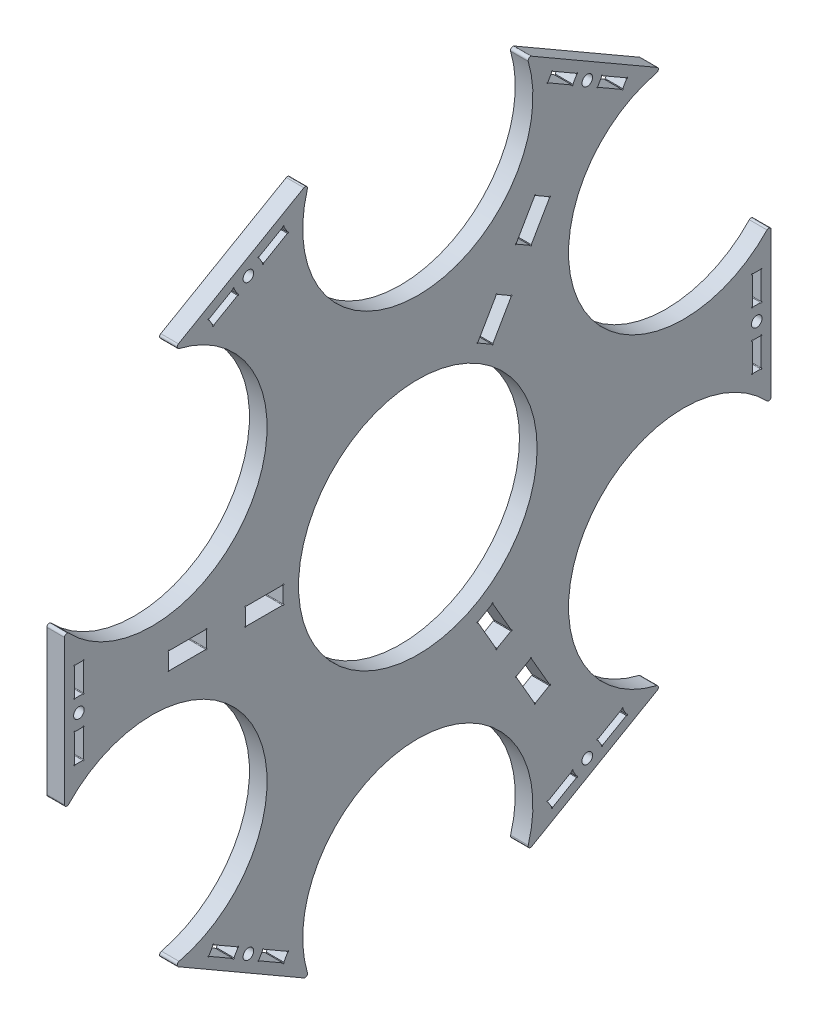
from build123d import *

# Parameters (mm, degrees)
SKETCH2_R           = 39.487475
BOSS_EXTRUDE1_DEPTH = 5.842
FILLET1_R           = 0.79375
SKETCH4_W           = 12.499999946
SKETCH4_H           = 5.742
CUT_EXTRUDE3_DEPTH  = 163.986308211
SKETCH5_R           = 0.1984375
CUT_EXTRUDE4_DEPTH  = 163.986308211
SKETCH6_R           = 1.7526
CUT_EXTRUDE5_DEPTH  = 163.986308211
CUT_EXTRUDE6_DEPTH  = 163.986308211


with BuildPart() as part:
    # Sketch2 → Boss-Extrude1 (new body)
    with BuildSketch(Plane(origin=(0, 0, 0), x_dir=(0, 0, -1), z_dir=(1, 0, 0))):
        with BuildLine():
            ThreePointArc((116.947215895, 26.041480267), (54.99261314, 31.75), (81.02619141, 88.258519733))
            Line((81.02619141, 88.258519733), (35.921024484, 114.3))
            ThreePointArc((35.921024484, 114.3), (0, 63.5), (-35.921024484, 114.3))
            Line((-35.921024484, 114.3), (-81.02619141, 88.258519733))
            ThreePointArc((-81.02619141, 88.258519733), (-54.99261314, 31.75), (-116.947215895, 26.041480267))
            Line((-116.947215895, 26.041480267), (-116.947215895, -26.041480267))
            ThreePointArc((-116.947215895, -26.041480267), (-54.99261314, -31.75), (-81.02619141, -88.258519733))
            Line((-81.02619141, -88.258519733), (-35.921024484, -114.3))
            ThreePointArc((-35.921024484, -114.3), (0, -63.5), (35.921024484, -114.3))
            Line((35.921024484, -114.3), (81.02619141, -88.258519733))
            ThreePointArc((81.02619141, -88.258519733), (54.99261314, -31.75), (116.947215895, -26.041480267))
            Line((116.947215895, -26.041480267), (116.947215895, 26.041480267))
        make_face()
        Circle(SKETCH2_R, mode=Mode.SUBTRACT)
    extrude(amount=BOSS_EXTRUDE1_DEPTH)

    # Fillet1
    fillet1_edges = [part.edges().sort_by_distance(p)[0] for p in [
        (2.921, -114.3, 35.921024484),
        (2.921, -114.3, -35.921024484),
        (2.921, -88.258519733, -81.02619141),
        (2.921, -26.041480267, -116.947215895),
        (2.921, 88.258519733, -81.02619141),
        (2.921, 26.041480267, -116.947215895),
        (2.921, -88.258519733, 81.02619141),
        (2.921, -26.041480267, 116.947215895),
        (2.921, 26.041480267, 116.947215895),
        (2.921, 88.258519733, 81.02619141),
        (2.921, 114.3, -35.921024484),
        (2.921, 114.3, 35.921024484),
    ]]
    fillet(fillet1_edges, radius=FILLET1_R)

    # Sketch4 → Cut-Extrude3 (cut, through all)
    with BuildSketch(Plane(origin=(5.842, 0, 0), x_dir=(0, 0, -1), z_dir=(1, 0, 0))):
        Polygon((26.038641052, 50.842249263), (19.788641079, 40.016931762), (24.761358948, 37.145931762), (31.011358921, 47.971249263), align=None)
        Polygon((31.011358921, -47.971249263), (24.761358948, -37.145931762), (19.788641079, -40.016931762), (26.038641052, -50.842249263), align=None)
        with Locations((-50.8, 0)):
            Rectangle(SKETCH4_W, SKETCH4_H)
    extrude(amount=-CUT_EXTRUDE3_DEPTH, mode=Mode.SUBTRACT)

    # Sketch5 → Cut-Extrude4 (cut, through all)
    with BuildSketch(Plane(origin=(5.842, 0, 0), x_dir=(0, 0, -1), z_dir=(1, 0, 0))):
        with Locations((26.038641052, 50.842249263)):
            Circle(SKETCH5_R)
        with Locations((31.011358921, 47.971249263)):
            Circle(SKETCH5_R)
        with Locations((24.761358948, 37.145931762)):
            Circle(SKETCH5_R)
        with Locations((19.788641079, 40.016931762)):
            Circle(SKETCH5_R)
        with Locations((31.011358921, -47.971249263)):
            Circle(SKETCH5_R)
        with Locations((26.038641052, -50.842249263)):
            Circle(SKETCH5_R)
        with Locations((19.788641079, -40.016931762)):
            Circle(SKETCH5_R)
        with Locations((24.761358948, -37.145931762)):
            Circle(SKETCH5_R)
        with Locations((-57.049999973, -2.871)):
            Circle(SKETCH5_R)
        with Locations((-57.049999973, 2.871)):
            Circle(SKETCH5_R)
        with Locations((-44.550000027, 2.871)):
            Circle(SKETCH5_R)
        with Locations((-44.550000027, -2.871)):
            Circle(SKETCH5_R)
    extrude(amount=-CUT_EXTRUDE4_DEPTH, mode=Mode.SUBTRACT)

    # Sketch6 → Cut-Extrude5 (cut, through all)
    with BuildSketch(Plane(origin=(5.842, 0, 0), x_dir=(0, 0, -1), z_dir=(1, 0, 0))):
        with Locations((-56.092357947, 97.154813881)):
            Circle(SKETCH6_R)
        with Locations((56.092357947, 97.154813881)):
            Circle(SKETCH6_R)
        with Locations((112.184715895, 0)):
            Circle(SKETCH6_R)
        with Locations((56.092357947, -97.154813881)):
            Circle(SKETCH6_R)
        with Locations((-56.092357947, -97.154813881)):
            Circle(SKETCH6_R)
        with Locations((-112.184715895, 0)):
            Circle(SKETCH6_R)
        with BuildLine():
            Line((-67.550093988, 88.822069843), (-59.644905849, 93.386132343))
            ThreePointArc((-59.644905849, 93.386132343), (-59.281378027, 93.433991689), (-59.572272683, 93.657203009))
            Line((-59.572272683, 93.657203009), (-60.861335183, 95.889924753))
            ThreePointArc((-60.861335183, 95.889924753), (-60.909194529, 96.253452575), (-61.132405849, 95.962557919))
            Line((-61.132405849, 95.962557919), (-69.037593988, 91.398495419))
            ThreePointArc((-69.037593988, 91.398495419), (-69.40112181, 91.350636074), (-69.110227154, 91.127424753))
            Line((-69.110227154, 91.127424753), (-67.821164654, 88.894703009))
            ThreePointArc((-67.821164654, 88.894703009), (-67.773305308, 88.531175187), (-67.550093988, 88.822069843))
        make_face()
        with BuildLine():
            Line((-44.634621907, 105.487557919), (-52.539810046, 100.923495419))
            ThreePointArc((-52.539810046, 100.923495419), (-52.903337868, 100.875636074), (-52.612443212, 100.652424753))
            Line((-52.612443212, 100.652424753), (-51.323380712, 98.419703009))
            ThreePointArc((-51.323380712, 98.419703009), (-51.275521366, 98.056175187), (-51.052310046, 98.347069843))
            Line((-51.052310046, 98.347069843), (-43.147121907, 102.911132343))
            ThreePointArc((-43.147121907, 102.911132343), (-42.783594085, 102.958991689), (-43.074488741, 103.182203009))
            Line((-43.074488741, 103.182203009), (-44.363551241, 105.414924753))
            ThreePointArc((-44.363551241, 105.414924753), (-44.411410587, 105.778452575), (-44.634621907, 105.487557919))
        make_face()
        with BuildLine():
            Line((43.147121907, 102.911132343), (51.052310046, 98.347069843))
            ThreePointArc((51.052310046, 98.347069843), (51.275521366, 98.056175187), (51.323380712, 98.419703009))
            Line((51.323380712, 98.419703009), (52.612443212, 100.652424753))
            ThreePointArc((52.612443212, 100.652424753), (52.903337868, 100.875636074), (52.539810046, 100.923495419))
            Line((52.539810046, 100.923495419), (44.634621907, 105.487557919))
            ThreePointArc((44.634621907, 105.487557919), (44.411410587, 105.778452575), (44.363551241, 105.414924753))
            Line((44.363551241, 105.414924753), (43.074488741, 103.182203009))
            ThreePointArc((43.074488741, 103.182203009), (42.783594085, 102.958991689), (43.147121907, 102.911132343))
        make_face()
        with BuildLine():
            Line((69.037593988, 91.398495419), (61.132405849, 95.962557919))
            ThreePointArc((61.132405849, 95.962557919), (60.909194529, 96.253452575), (60.861335183, 95.889924753))
            Line((60.861335183, 95.889924753), (59.572272683, 93.657203009))
            ThreePointArc((59.572272683, 93.657203009), (59.281378027, 93.433991689), (59.644905849, 93.386132343))
            Line((59.644905849, 93.386132343), (67.550093988, 88.822069843))
            ThreePointArc((67.550093988, 88.822069843), (67.773305308, 88.531175187), (67.821164654, 88.894703009))
            Line((67.821164654, 88.894703009), (69.110227154, 91.127424753))
            ThreePointArc((69.110227154, 91.127424753), (69.40112181, 91.350636074), (69.037593988, 91.398495419))
        make_face()
        with BuildLine():
            Line((110.697215895, 14.0890625), (110.697215895, 4.9609375))
            ThreePointArc((110.697215895, 4.9609375), (110.556899393, 4.622183498), (110.895653395, 4.7625))
            Line((110.895653395, 4.7625), (113.473778395, 4.7625))
            ThreePointArc((113.473778395, 4.7625), (113.812532397, 4.622183498), (113.672215895, 4.9609375))
            Line((113.672215895, 4.9609375), (113.672215895, 14.0890625))
            ThreePointArc((113.672215895, 14.0890625), (113.812532397, 14.427816502), (113.473778395, 14.2875))
            Line((113.473778395, 14.2875), (110.895653395, 14.2875))
            ThreePointArc((110.895653395, 14.2875), (110.556899393, 14.427816502), (110.697215895, 14.0890625))
        make_face()
        with BuildLine():
            Line((113.672215895, -14.0890625), (113.672215895, -4.9609375))
            ThreePointArc((113.672215895, -4.9609375), (113.812532397, -4.622183498), (113.473778395, -4.7625))
            Line((113.473778395, -4.7625), (110.895653395, -4.7625))
            ThreePointArc((110.895653395, -4.7625), (110.556899393, -4.622183498), (110.697215895, -4.9609375))
            Line((110.697215895, -4.9609375), (110.697215895, -14.0890625))
            ThreePointArc((110.697215895, -14.0890625), (110.556899393, -14.427816502), (110.895653395, -14.2875))
            Line((110.895653395, -14.2875), (113.473778395, -14.2875))
            ThreePointArc((113.473778395, -14.2875), (113.812532397, -14.427816502), (113.672215895, -14.0890625))
        make_face()
        with BuildLine():
            Line((67.550093988, -88.822069843), (59.644905849, -93.386132343))
            ThreePointArc((59.644905849, -93.386132343), (59.281378027, -93.433991689), (59.572272683, -93.657203009))
            Line((59.572272683, -93.657203009), (60.861335183, -95.889924753))
            ThreePointArc((60.861335183, -95.889924753), (60.909194529, -96.253452575), (61.132405849, -95.962557919))
            Line((61.132405849, -95.962557919), (69.037593988, -91.398495419))
            ThreePointArc((69.037593988, -91.398495419), (69.40112181, -91.350636074), (69.110227154, -91.127424753))
            Line((69.110227154, -91.127424753), (67.821164654, -88.894703009))
            ThreePointArc((67.821164654, -88.894703009), (67.773305308, -88.531175187), (67.550093988, -88.822069843))
        make_face()
        with BuildLine():
            Line((44.634621907, -105.487557919), (52.539810046, -100.923495419))
            ThreePointArc((52.539810046, -100.923495419), (52.903337868, -100.875636074), (52.612443212, -100.652424753))
            Line((52.612443212, -100.652424753), (51.323380712, -98.419703009))
            ThreePointArc((51.323380712, -98.419703009), (51.275521366, -98.056175187), (51.052310046, -98.347069843))
            Line((51.052310046, -98.347069843), (43.147121907, -102.911132343))
            ThreePointArc((43.147121907, -102.911132343), (42.783594085, -102.958991689), (43.074488741, -103.182203009))
            Line((43.074488741, -103.182203009), (44.363551241, -105.414924753))
            ThreePointArc((44.363551241, -105.414924753), (44.411410587, -105.778452575), (44.634621907, -105.487557919))
        make_face()
        with BuildLine():
            Line((-43.147121907, -102.911132343), (-51.052310046, -98.347069843))
            ThreePointArc((-51.052310046, -98.347069843), (-51.275521366, -98.056175187), (-51.323380712, -98.419703009))
            Line((-51.323380712, -98.419703009), (-52.612443212, -100.652424753))
            ThreePointArc((-52.612443212, -100.652424753), (-52.903337868, -100.875636074), (-52.539810046, -100.923495419))
            Line((-52.539810046, -100.923495419), (-44.634621907, -105.487557919))
            ThreePointArc((-44.634621907, -105.487557919), (-44.411410587, -105.778452575), (-44.363551241, -105.414924753))
            Line((-44.363551241, -105.414924753), (-43.074488741, -103.182203009))
            ThreePointArc((-43.074488741, -103.182203009), (-42.783594085, -102.958991689), (-43.147121907, -102.911132343))
        make_face()
        with BuildLine():
            Line((-69.037593988, -91.398495419), (-61.132405849, -95.962557919))
            ThreePointArc((-61.132405849, -95.962557919), (-60.909194529, -96.253452575), (-60.861335183, -95.889924753))
            Line((-60.861335183, -95.889924753), (-59.572272683, -93.657203009))
            ThreePointArc((-59.572272683, -93.657203009), (-59.281378027, -93.433991689), (-59.644905849, -93.386132343))
            Line((-59.644905849, -93.386132343), (-67.550093988, -88.822069843))
            ThreePointArc((-67.550093988, -88.822069843), (-67.773305308, -88.531175187), (-67.821164654, -88.894703009))
            Line((-67.821164654, -88.894703009), (-69.110227154, -91.127424753))
            ThreePointArc((-69.110227154, -91.127424753), (-69.40112181, -91.350636074), (-69.037593988, -91.398495419))
        make_face()
        with BuildLine():
            Line((-110.697215895, -14.0890625), (-110.697215895, -4.9609375))
            ThreePointArc((-110.697215895, -4.9609375), (-110.556899393, -4.622183498), (-110.895653395, -4.7625))
            Line((-110.895653395, -4.7625), (-113.473778395, -4.7625))
            ThreePointArc((-113.473778395, -4.7625), (-113.812532397, -4.622183498), (-113.672215895, -4.9609375))
            Line((-113.672215895, -4.9609375), (-113.672215895, -14.0890625))
            ThreePointArc((-113.672215895, -14.0890625), (-113.812532397, -14.427816502), (-113.473778395, -14.2875))
            Line((-113.473778395, -14.2875), (-110.895653395, -14.2875))
            ThreePointArc((-110.895653395, -14.2875), (-110.556899393, -14.427816502), (-110.697215895, -14.0890625))
        make_face()
        with BuildLine():
            Line((-113.672215895, 14.0890625), (-113.672215895, 4.9609375))
            ThreePointArc((-113.672215895, 4.9609375), (-113.812532397, 4.622183498), (-113.473778395, 4.7625))
            Line((-113.473778395, 4.7625), (-110.895653395, 4.7625))
            ThreePointArc((-110.895653395, 4.7625), (-110.556899393, 4.622183498), (-110.697215895, 4.9609375))
            Line((-110.697215895, 4.9609375), (-110.697215895, 14.0890625))
            ThreePointArc((-110.697215895, 14.0890625), (-110.556899393, 14.427816502), (-110.895653395, 14.2875))
            Line((-110.895653395, 14.2875), (-113.473778395, 14.2875))
            ThreePointArc((-113.473778395, 14.2875), (-113.812532397, 14.427816502), (-113.672215895, 14.0890625))
        make_face()
    extrude(amount=-CUT_EXTRUDE5_DEPTH, mode=Mode.SUBTRACT)

    # Sketch7 → Cut-Extrude6 (cut, through all)
    with BuildSketch(Plane(origin=(5.842, 0, 0), x_dir=(0, 0, -1), z_dir=(1, 0, 0))):
        with BuildLine():
            Line((38.910492968, -72.740075769), (43.539507005, -70.067513269))
            ThreePointArc((43.539507005, -70.067513269), (43.903034827, -70.019653923), (43.612140171, -69.796442603))
            Line((43.612140171, -69.796442603), (37.560577698, -59.314828934))
            ThreePointArc((37.560577698, -59.314828934), (37.512718352, -58.951301112), (37.289507032, -59.242195768))
            Line((37.289507032, -59.242195768), (32.660492995, -61.914758268))
            ThreePointArc((32.660492995, -61.914758268), (32.296965173, -61.962617614), (32.587859829, -62.185828934))
            Line((32.587859829, -62.185828934), (38.639422302, -72.667442603))
            ThreePointArc((38.639422302, -72.667442603), (38.687281648, -73.030970425), (38.910492968, -72.740075769))
        make_face()
        with BuildLine():
            Line((43.539507005, 70.067513269), (38.910492968, 72.740075769))
            ThreePointArc((38.910492968, 72.740075769), (38.687281648, 73.030970425), (38.639422302, 72.667442603))
            Line((38.639422302, 72.667442603), (32.587859829, 62.185828934))
            ThreePointArc((32.587859829, 62.185828934), (32.296965173, 61.962617614), (32.660492995, 61.914758268))
            Line((32.660492995, 61.914758268), (37.289507032, 59.242195768))
            ThreePointArc((37.289507032, 59.242195768), (37.512718352, 58.951301112), (37.560577698, 59.314828934))
            Line((37.560577698, 59.314828934), (43.612140171, 69.796442603))
            ThreePointArc((43.612140171, 69.796442603), (43.903034827, 70.019653923), (43.539507005, 70.067513269))
        make_face()
        with BuildLine():
            Line((-82.449999973, 2.6725625), (-82.449999973, -2.6725625))
            ThreePointArc((-82.449999973, -2.6725625), (-82.590316475, -3.011316502), (-82.251562473, -2.871))
            Line((-82.251562473, -2.871), (-70.148437527, -2.871))
            ThreePointArc((-70.148437527, -2.871), (-69.809683525, -3.011316502), (-69.950000027, -2.6725625))
            Line((-69.950000027, -2.6725625), (-69.950000027, 2.6725625))
            ThreePointArc((-69.950000027, 2.6725625), (-69.809683525, 3.011316502), (-70.148437527, 2.871))
            Line((-70.148437527, 2.871), (-82.251562473, 2.871))
            ThreePointArc((-82.251562473, 2.871), (-82.590316475, 3.011316502), (-82.449999973, 2.6725625))
        make_face()
    extrude(amount=-CUT_EXTRUDE6_DEPTH, mode=Mode.SUBTRACT)


solid = part.part
